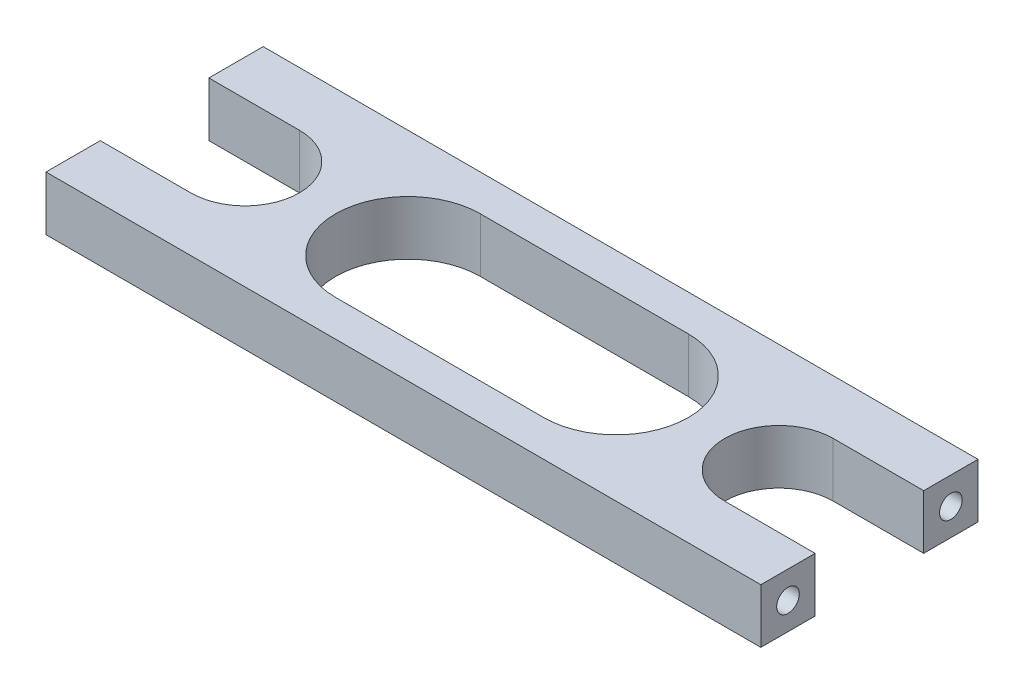
from build123d import *

# Parameters (mm, degrees)
SKETCH1_W                   = 79
SKETCH1_H                   = 24
BOSS_EXTRUDE1_DEPTH         = 6
CUT_EXTRUDE1_REACH          = 84.783
TAP_DRILL_FOR_M3_TAP1_D     = 2.5
TAP_DRILL_FOR_M3_TAP1_DEPTH = 10
TAP_DRILL_FOR_M3_TAP1_TIP   = 0.751075774
TAP_DRILL_FOR_M3_TAP2_D     = 2.5
TAP_DRILL_FOR_M3_TAP2_DEPTH = 10
TAP_DRILL_FOR_M3_TAP2_TIP   = 0.751075774


with BuildPart() as part:
    # Sketch1 → Boss-Extrude1 (new body)
    with BuildSketch(Plane(origin=(0, 0, 0), x_dir=(1, 0, 0), z_dir=(0, 1, 0))):
        with Locations((39.5, 12)):
            Rectangle(SKETCH1_W, SKETCH1_H)
    extrude(amount=BOSS_EXTRUDE1_DEPTH)

    # Sketch2 → Cut-Extrude1 (cut, up to next)
    with BuildSketch(Plane(origin=(0, 6, 0), x_dir=(1, 0, 0), z_dir=(0, 1, 0)), mode=Mode.PRIVATE) as cut_extrude1_sk1:
        with BuildLine():
            Line((0, 18), (10, 18))
            ThreePointArc((10, 18), (16, 12), (10, 6))
            Line((10, 6), (0, 6))
            ThreePointArc((0, 6), (-6, 12), (0, 18))
        make_face()
    cut_extrude1_tool1 = extrude(cut_extrude1_sk1.sketch, amount=-CUT_EXTRUDE1_REACH, mode=Mode.PRIVATE) & part.part
    # Sketch2 → Cut-Extrude1 (cut, up to next)
    with BuildSketch(Plane(origin=(0, 6, 0), x_dir=(1, 0, 0), z_dir=(0, 1, 0)), mode=Mode.PRIVATE) as cut_extrude1_sk2:
        with BuildLine():
            Line((79, 6), (69, 6))
            ThreePointArc((69, 6), (63, 12), (69, 18))
            Line((69, 18), (79, 18))
            ThreePointArc((79, 18), (85, 12), (79, 6))
        make_face()
    cut_extrude1_tool2 = extrude(cut_extrude1_sk2.sketch, amount=-CUT_EXTRUDE1_REACH, mode=Mode.PRIVATE) & part.part
    # Sketch2 → Cut-Extrude1 (cut, up to next)
    with BuildSketch(Plane(origin=(0, 6, 0), x_dir=(1, 0, 0), z_dir=(0, 1, 0)), mode=Mode.PRIVATE) as cut_extrude1_sk3:
        with BuildLine():
            Line((28, 20), (51, 20))
            ThreePointArc((51, 20), (59, 12), (51, 4))
            Line((51, 4), (28, 4))
            ThreePointArc((28, 4), (20, 12), (28, 20))
        make_face()
    cut_extrude1_tool3 = extrude(cut_extrude1_sk3.sketch, amount=-CUT_EXTRUDE1_REACH, mode=Mode.PRIVATE) & part.part
    add(cut_extrude1_tool1.solids().sort_by_distance((5, 6, -12))[0], mode=Mode.SUBTRACT)
    add(cut_extrude1_tool2.solids().sort_by_distance((74, 6, -12))[0], mode=Mode.SUBTRACT)
    add(cut_extrude1_tool3.solids().sort_by_distance((39.5, 6, -12))[0], mode=Mode.SUBTRACT)

    # Tap Drill for M3 Tap1
    with Locations(Plane.ZY):
        with Locations((-21, 3), (-3, 3)):
            Hole(TAP_DRILL_FOR_M3_TAP1_D / 2, depth=TAP_DRILL_FOR_M3_TAP1_DEPTH)
            with Locations((0, 0, -(TAP_DRILL_FOR_M3_TAP1_DEPTH + TAP_DRILL_FOR_M3_TAP1_TIP / 2))):  # 118° drill point
                Cone(0, TAP_DRILL_FOR_M3_TAP1_D / 2, TAP_DRILL_FOR_M3_TAP1_TIP, mode=Mode.SUBTRACT)

    # Tap Drill for M3 Tap2
    with Locations(Plane(origin=(79, 0, 0), x_dir=(0, 0, -1), z_dir=(1, 0, 0))):
        with Locations((3, 3), (21, 3)):
            Hole(TAP_DRILL_FOR_M3_TAP2_D / 2, depth=TAP_DRILL_FOR_M3_TAP2_DEPTH)
            with Locations((0, 0, -(TAP_DRILL_FOR_M3_TAP2_DEPTH + TAP_DRILL_FOR_M3_TAP2_TIP / 2))):  # 118° drill point
                Cone(0, TAP_DRILL_FOR_M3_TAP2_D / 2, TAP_DRILL_FOR_M3_TAP2_TIP, mode=Mode.SUBTRACT)


solid = part.part
